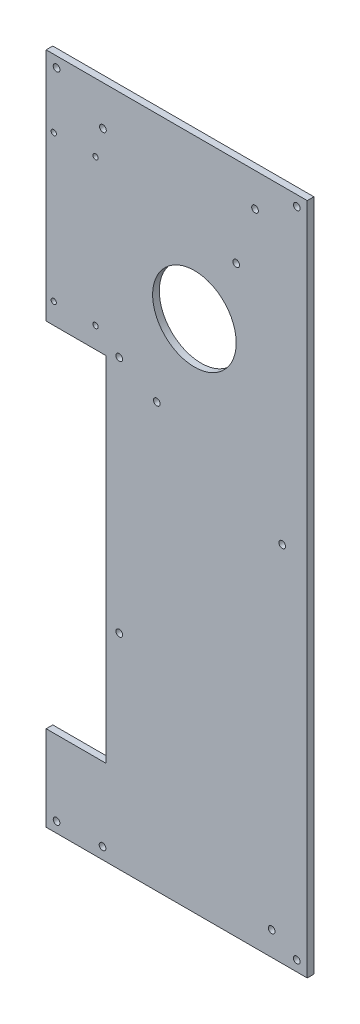
from build123d import *

# Parameters (mm, degrees)
SKETCH1_R           = 1.6
SKETCH1_R_2         = 20
SKETCH1_R_3         = 1.25
BOSS_EXTRUDE1_DEPTH = 3.18


with BuildPart() as part:
    # Sketch1 → Boss-Extrude1 (new body)
    with BuildSketch(Plane(origin=(0, 0, 0), x_dir=(0, 1, 0), z_dir=(0, 0, 1))):
        Polygon((-98, 35), (-98, -90), (224.3, -90), (224.3, 35), (111.85, 35), (111.85, 6.35), (-57.15, 6.35), (-57.15, 35), align=None)
        with Locations((-92.5, 8)):
            Circle(SKETCH1_R, mode=Mode.SUBTRACT)
        with Locations((-93, 30)):
            Circle(SKETCH1_R, mode=Mode.SUBTRACT)
        with Locations((205.3, 7.8)):
            Circle(SKETCH1_R, mode=Mode.SUBTRACT)
        with Locations((114.3, 0)):
            Circle(SKETCH1_R, mode=Mode.SUBTRACT)
        with Locations((-93, -85)):
            Circle(SKETCH1_R, mode=Mode.SUBTRACT)
        with Locations((-86.5, -73)):
            Circle(SKETCH1_R, mode=Mode.SUBTRACT)
        with Locations((75.7, -78)):
            Circle(SKETCH1_R, mode=Mode.SUBTRACT)
        with Locations((219.3, -85)):
            Circle(SKETCH1_R, mode=Mode.SUBTRACT)
        with Locations((208.3, -65)):
            Circle(SKETCH1_R, mode=Mode.SUBTRACT)
        with Locations((181.3, -56)):
            Circle(SKETCH1_R, mode=Mode.SUBTRACT)
        with Locations((148.3, -36)):
            Circle(SKETCH1_R_2, mode=Mode.SUBTRACT)
        Circle(SKETCH1_R, mode=Mode.SUBTRACT)
        with Locations((104.8, -18)):
            Circle(SKETCH1_R, mode=Mode.SUBTRACT)
        with Locations((191.85, 31.35)):
            Circle(SKETCH1_R_3, mode=Mode.SUBTRACT)
        with Locations((121.85, 11.35)):
            Circle(SKETCH1_R_3, mode=Mode.SUBTRACT)
        with Locations((121.85, 31.35)):
            Circle(SKETCH1_R_3, mode=Mode.SUBTRACT)
        with Locations((191.85, 11.35)):
            Circle(SKETCH1_R_3, mode=Mode.SUBTRACT)
        with Locations((219.3, 30)):
            Circle(SKETCH1_R, mode=Mode.SUBTRACT)
    extrude(amount=-BOSS_EXTRUDE1_DEPTH)


solid = part.part
